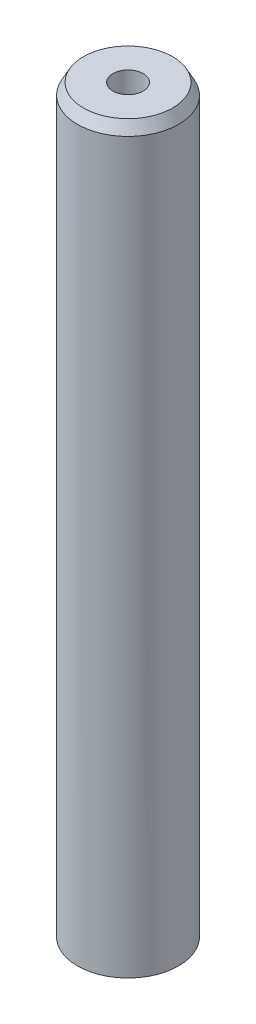
from build123d import *
from OCP.BRepFilletAPI import BRepFilletAPI_MakeChamfer

# Parameters (mm, degrees)
SKETCH1_R           = 5
BOSS_EXTRUDE1_DEPTH = 73.759273796
SKETCH2_R           = 1.498796978
CUT_EXTRUDE1_DEPTH  = 75.097439031
CHAMFER1_SIZE       = 1.099666483
CHAMFER1_SIZE2      = 0.596093348


with BuildPart() as part:
    # Sketch1 → Boss-Extrude1 (new body)
    with BuildSketch(Plane(origin=(0, 0, 0), x_dir=(1, 0, 0), z_dir=(0, 1, 0))):
        Circle(SKETCH1_R)
    extrude(amount=BOSS_EXTRUDE1_DEPTH)

    # Sketch2 → Cut-Extrude1 (cut, through all)
    with BuildSketch(Plane(origin=(0, 0, 0), x_dir=(1, 0, 0), z_dir=(0, 1, 0))):
        Circle(SKETCH2_R)
    extrude(amount=CUT_EXTRUDE1_DEPTH, mode=Mode.SUBTRACT)

    # Chamfer1: one chamfer whose edges measure the first distance from different faces: ONE call of the kernel's chamfer builder (chamfer() names one face for all edges)
    chamfer1_edges_1 = [part.edges().sort_by_distance(p)[0] for p in [
        (-5, 73.759273796, 0),
    ]]
    chamfer1_side_1 = [part.faces().sort_by_distance(p)[0] for p in [
        (-5, 36.879636898, 0),
    ]]
    chamfer1_edges_2 = [part.edges().sort_by_distance(p)[0] for p in [
        (-5, 0, 0),
    ]]
    chamfer1_side_2 = [part.faces().sort_by_distance(p)[0] for p in [
        (-4.858578644, 0, 0),
    ]]
    chamfer1 = BRepFilletAPI_MakeChamfer(part.part.solid().wrapped)
    for e in chamfer1_edges_1:
        chamfer1.Add(CHAMFER1_SIZE, CHAMFER1_SIZE2, e.wrapped, chamfer1_side_1[0].wrapped)  # the first distance lies on this face
    for e in chamfer1_edges_2:
        chamfer1.Add(CHAMFER1_SIZE, CHAMFER1_SIZE2, e.wrapped, chamfer1_side_2[0].wrapped)  # the first distance lies on this face
    add(Compound.cast(chamfer1.Shape()), mode=Mode.REPLACE)


solid = part.part
